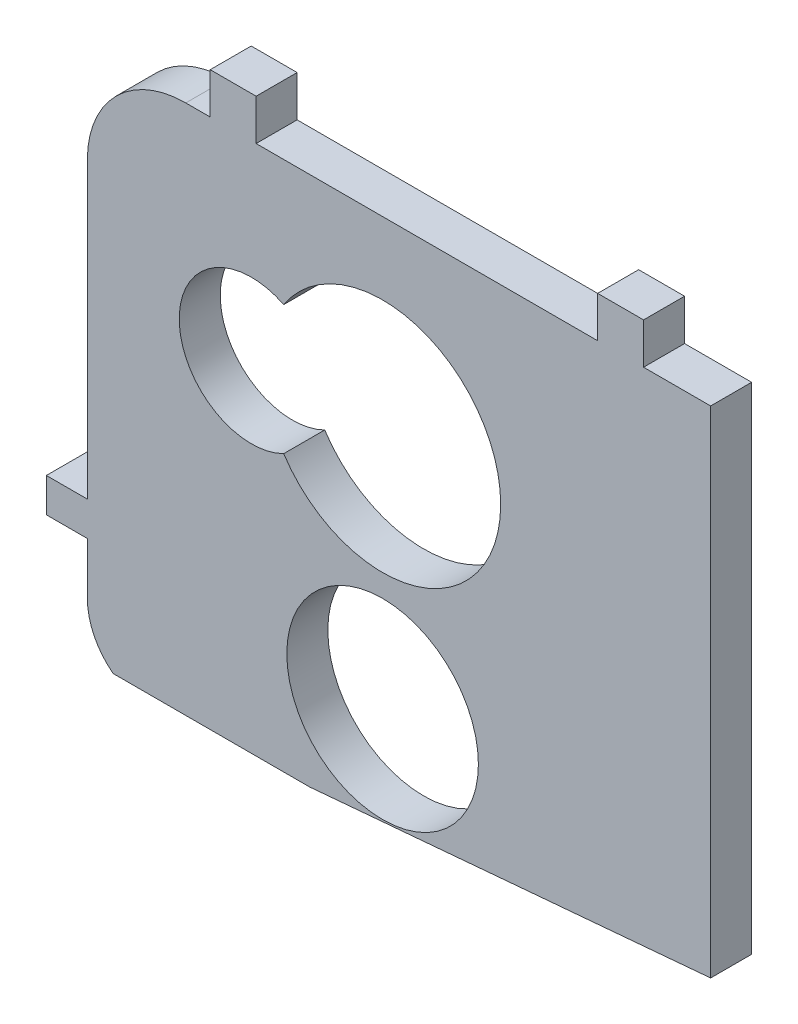
from build123d import *

# Parameters (mm, degrees)
SKETCH1_R           = 3.7084
BOSS_EXTRUDE1_DEPTH = 1.5875


with BuildPart() as part:
    # Sketch1 → Boss-Extrude1 (new body)
    with BuildSketch(Plane.XY):
        with BuildLine():
            Line((-10.431265191, -4.028360607), (-2.823309713, -4.028360607))
            Line((-2.823309713, -4.028360607), (12.7, -2.670246987))
            Line((12.7, -2.670246987), (12.7, 16.51))
            Line((12.7, 16.51), (10.10362126, 16.51))
            Line((10.10362126, 16.51), (10.10362126, 18.0975))
            Line((10.10362126, 18.0975), (8.32562126, 18.0975))
            Line((8.32562126, 18.0975), (8.32562126, 16.51))
            Line((8.32562126, 16.51), (-4.89637874, 16.51))
            Line((-4.89637874, 16.51), (-4.89637874, 18.0975))
            Line((-4.89637874, 18.0975), (-6.67437874, 18.0975))
            Line((-6.67437874, 18.0975), (-6.67437874, 16.51))
            Line((-6.67437874, 16.51), (-7.62, 16.51))
            ThreePointArc((-7.62, 16.51), (-10.314076836, 15.394076836), (-11.43, 12.7))
            Line((-11.43, 12.7), (-11.43, 1.3208))
            Line((-11.43, 1.3208), (-13.0175, 1.3208))
            Line((-13.0175, 1.3208), (-13.0175, 0))
            Line((-13.0175, 0), (-11.43, 0))
            Line((-11.43, 0), (-11.43, -2.009424845))
            ThreePointArc((-11.43, -2.009424845), (-11.166665718, -3.135654487), (-10.431265191, -4.028360607))
        make_face()
        Circle(SKETCH1_R, mode=Mode.SUBTRACT)
        with BuildLine():
            ThreePointArc((-3.82905, 11.642311449), (4.572, 9.144), (-3.82905, 6.645688551))
            ThreePointArc((-3.82905, 6.645688551), (-7.874, 9.144), (-3.82905, 11.642311449))
        make_face(mode=Mode.SUBTRACT)
    extrude(amount=BOSS_EXTRUDE1_DEPTH)


solid = part.part
